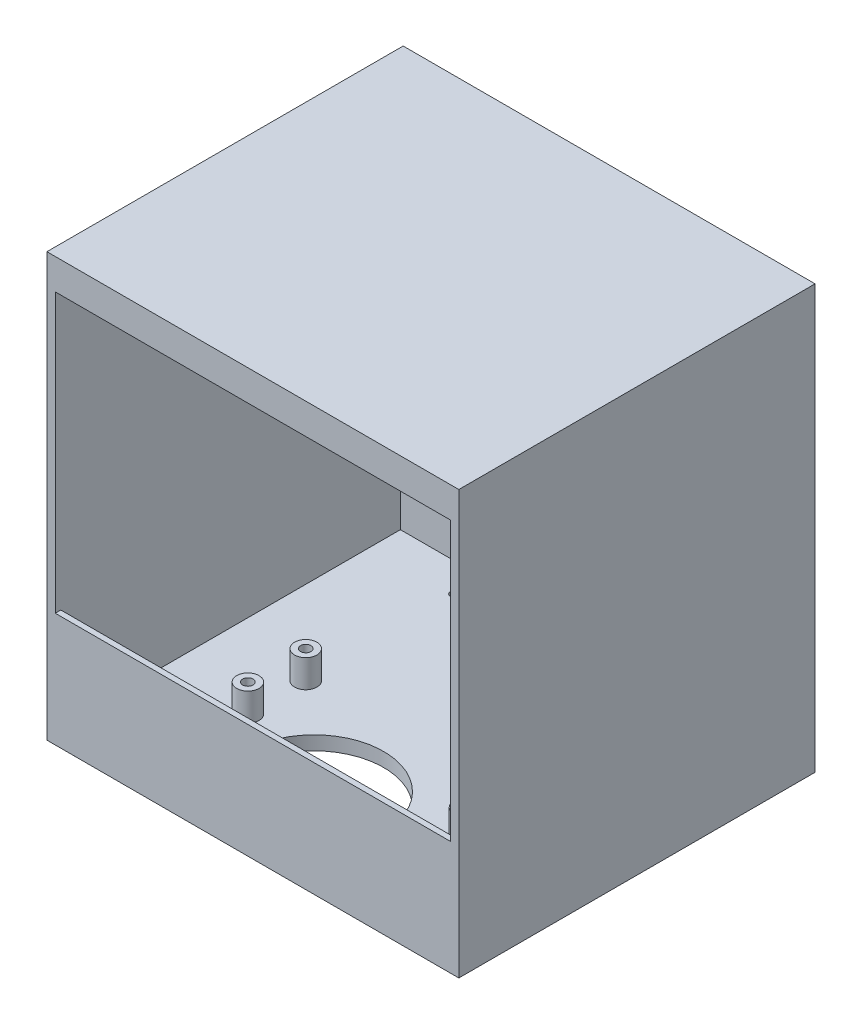
from build123d import *

# Parameters (mm, degrees)
SKETCH1_W                             = 469.9
SKETCH1_H                             = 482.6
FULL_BOX_DEPTH                        = 406.4
SKETCH2_W                             = 450.85
SKETCH2_H                             = 317.5
INSIDE_CUT_DEPTH                      = 393.7
SKETCH3_W                             = 450.85
SKETCH3_H                             = 387.35
FLOOR_CUT_DEPTH                       = 114.3
SKETCH4_R                             = 79.375
DRAIN_HOLE_DEPTH                      = 778.045169617
SKETCH5_R                             = 12.7
PEGS_DEPTH                            = 31.75
PEGS_2_DEPTH                          = 31.75
PEGS_3_DEPTH                          = 31.75
PEGS_4_DEPTH                          = 31.75
HOLES_IN_PEGS_AT_2_COUNT              = 2
HOLES_IN_PEGS_AT_2_PITCH              = 66.04
HOLES_IN_PEGS_AT_3_COUNT              = 2
HOLES_IN_PEGS_AT_3_PITCH              = 256.304124235
HOLES_IN_PEGS_AT_4_COUNT              = 2
HOLES_IN_PEGS_AT_4_PITCH              = 247.65
F_1_4_18_NPSM_TAPPED_HOLE3_AT_2_COUNT = 2
F_1_4_18_NPSM_TAPPED_HOLE3_AT_2_PITCH = 247.65


with BuildPart() as part:
    # Sketch1 → full box (new body)
    with BuildSketch(Plane.XY):
        with Locations((234.95, -241.3)):
            Rectangle(SKETCH1_W, SKETCH1_H)
    extrude(amount=-FULL_BOX_DEPTH)

    # Sketch2 → inside cut (cut)
    with BuildSketch(Plane.XY):
        with Locations((234.95, -193.675)):
            Rectangle(SKETCH2_W, SKETCH2_H)
    extrude(amount=-INSIDE_CUT_DEPTH, mode=Mode.SUBTRACT)

    # Sketch3 → floor cut (cut)
    with BuildSketch(Plane(origin=(0, -352.425, 0), x_dir=(1, 0, 0), z_dir=(0, 1, 0))):
        with Locations((234.95, 200.025)):
            Rectangle(SKETCH3_W, SKETCH3_H)
    extrude(amount=-FLOOR_CUT_DEPTH, mode=Mode.SUBTRACT)

    # Sketch4 → drain hole (cut, through all)
    with BuildSketch(Plane(origin=(0, -466.725, 0), x_dir=(1, 0, 0), z_dir=(0, 1, 0))):
        with Locations((219.075, 85.725)):
            Circle(SKETCH4_R)
    extrude(amount=-DRAIN_HOLE_DEPTH, mode=Mode.SUBTRACT)


with BuildPart() as body_2:
    # Sketch5 → pegs (new body)
    with BuildSketch(Plane(origin=(0, -466.725, 0), x_dir=(1, 0, 0), z_dir=(0, 1, 0))):
        with Locations((104.775, 124.46)):
            Circle(SKETCH5_R)
    extrude(amount=PEGS_DEPTH)


with BuildPart() as body_3:
    # Sketch5 → pegs 2 (new body)
    with BuildSketch(Plane(origin=(0, -466.725, 0), x_dir=(1, 0, 0), z_dir=(0, 1, 0))):
        with Locations((352.425, 124.46)):
            Circle(SKETCH5_R)
    extrude(amount=PEGS_2_DEPTH)


with BuildPart() as body_4:
    # Sketch5 → pegs 3 (new body)
    with BuildSketch(Plane(origin=(0, -466.725, 0), x_dir=(1, 0, 0), z_dir=(0, 1, 0))):
        with Locations((352.425, 190.5)):
            Circle(SKETCH5_R)
    extrude(amount=PEGS_3_DEPTH)


with BuildPart() as body_5:
    # Sketch5 → pegs 4 (new body)
    with BuildSketch(Plane(origin=(0, -466.725, 0), x_dir=(1, 0, 0), z_dir=(0, 1, 0))):
        with Locations((104.775, 190.5)):
            Circle(SKETCH5_R)
    extrude(amount=PEGS_4_DEPTH)


with BuildPart() as holes_in_pegs_tool:
    # Sketch19 → holes in pegs (revolve)
    with BuildSketch(Plane(origin=(104.775, -434.975, -124.46), x_dir=(0, 0, 1), z_dir=(1, 0, 0))):
        Polygon((0, 0), (0, 35.321275175), (5.9436, 31.75), (5.9436, 0), align=None)
    holes_in_pegs = revolve(axis=Axis((104.775, -428.625, -124.46), (0, -1, 0)))


with BuildPart() as part_1:
    add(part.part)

    # holes in pegs: cut by holes_in_pegs_tool
    add(holes_in_pegs_tool.part, mode=Mode.SUBTRACT)


with BuildPart() as body_2_1:
    add(body_2.part)

    # holes in pegs: cut by holes_in_pegs_tool
    add(holes_in_pegs_tool.part, mode=Mode.SUBTRACT)


with BuildPart() as holes_in_pegs_at_2_tool:
    # holes in pegs at 2: holes in pegs ×2
    with Locations(*[(0, 0, -i * HOLES_IN_PEGS_AT_2_PITCH) for i in range(1, HOLES_IN_PEGS_AT_2_COUNT)]):
        add(holes_in_pegs)


with BuildPart() as part_2:
    add(part_1.part)

    # holes in pegs at 2: cut by holes_in_pegs_at_2_tool
    add(holes_in_pegs_at_2_tool.part, mode=Mode.SUBTRACT)


with BuildPart() as body_5_1:
    add(body_5.part)

    # holes in pegs at 2: cut by holes_in_pegs_at_2_tool
    add(holes_in_pegs_at_2_tool.part, mode=Mode.SUBTRACT)


with BuildPart() as holes_in_pegs_at_3_tool:
    # holes in pegs at 3: holes in pegs ×2
    with Locations(*[Vector(0.9662349396012463, 0, -0.2576626505603324) * (i * HOLES_IN_PEGS_AT_3_PITCH) for i in range(1, HOLES_IN_PEGS_AT_3_COUNT)]):
        add(holes_in_pegs)


with BuildPart() as part_3:
    add(part_2.part)

    # holes in pegs at 3: cut by holes_in_pegs_at_3_tool
    add(holes_in_pegs_at_3_tool.part, mode=Mode.SUBTRACT)


with BuildPart() as body_4_1:
    add(body_4.part)

    # holes in pegs at 3: cut by holes_in_pegs_at_3_tool
    add(holes_in_pegs_at_3_tool.part, mode=Mode.SUBTRACT)


with BuildPart() as holes_in_pegs_at_4_tool:
    # holes in pegs at 4: holes in pegs ×2
    with Locations(*[(i * HOLES_IN_PEGS_AT_4_PITCH, 0, 0) for i in range(1, HOLES_IN_PEGS_AT_4_COUNT)]):
        add(holes_in_pegs)


with BuildPart() as part_4:
    add(part_3.part)

    # holes in pegs at 4: cut by holes_in_pegs_at_4_tool
    add(holes_in_pegs_at_4_tool.part, mode=Mode.SUBTRACT)

    # Sketch24 → 1/4-18 NPSM Tapped Hole3 (revolve, cut)
    with BuildSketch(Plane(origin=(104.775, -466.725, -361.95), x_dir=(0, 0, 1), z_dir=(1, 0, 0))):
        Polygon((0, 0), (0, 35.321275175), (5.9436, 31.75), (5.9436, 0), align=None)
    f_1_4_18_npsm_tapped_hole3 = revolve(axis=Axis((104.775, -460.375, -361.95), (0, -1, 0)), mode=Mode.SUBTRACT)

    # 1/4-18 NPSM Tapped Hole3 at 2: 1/4-18 NPSM Tapped Hole3 ×2
    with Locations(*[(i * F_1_4_18_NPSM_TAPPED_HOLE3_AT_2_PITCH, 0, 0) for i in range(1, F_1_4_18_NPSM_TAPPED_HOLE3_AT_2_COUNT)]):
        add(f_1_4_18_npsm_tapped_hole3, mode=Mode.SUBTRACT)


with BuildPart() as body_3_1:
    add(body_3.part)

    # holes in pegs at 4: cut by holes_in_pegs_at_4_tool
    add(holes_in_pegs_at_4_tool.part, mode=Mode.SUBTRACT)


solid = Compound([body_2_1.part, body_5_1.part, body_4_1.part, part_4.part, body_3_1.part])
